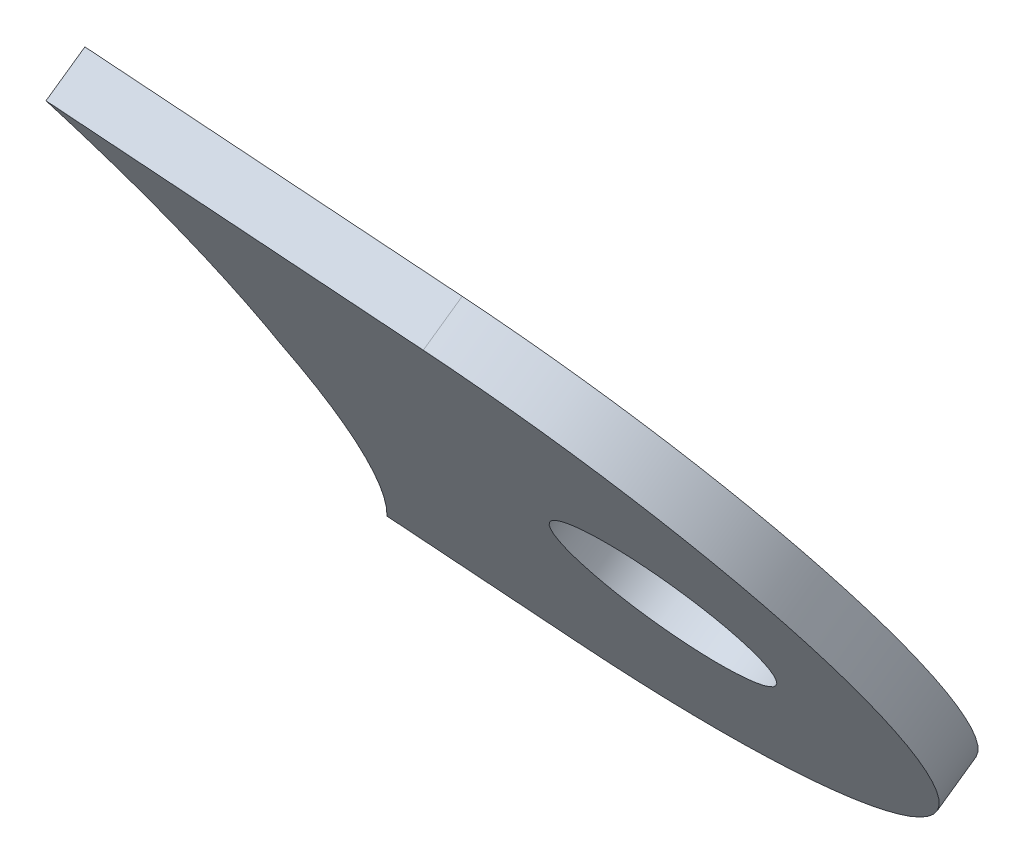
from build123d import *

# Parameters (mm, degrees)
SKETCH1_R           = 3.3019999999999836
BOSS_EXTRUDE1_DEPTH = 1.5875
SKETCH2_R           = 12.7
CUT_EXTRUDE2_DEPTH  = 146.57558110485613
CUT_EXTRUDE3_DEPTH  = 400.917308055041
CUT_EXTRUDE4_DEPTH  = 400.91690405439095


with BuildPart() as part:
    # Sketch1 → Boss-Extrude1 (new body)
    with BuildSketch(Plane(origin=(4.715e-14, 220.81273991226263, -315.3532743689599), x_dir=(-1, 7e-17, -1e-16), z_dir=(0, 0.5735764363510497, -0.8191520442889892))):
        with BuildLine():
            Line((-352.9368830837315, 115.82645369700992), (-375.29590907686907, 107.8750150529707))
            ThreePointArc((-375.29590907686907, 107.8750150529707), (-383.0064063960404, 91.65378726062865), (-366.7851786036984, 83.94328994145738))
            Line((-366.7851786036984, 83.94328994145738), (-352.9368830837315, 88.86809624497586))
            Line((-352.9368830837315, 88.86809624497586), (-352.9368830837315, 115.82645369700992))
        make_face()
        with Locations((-375.5277422986924, 94.31339053349453)):
            Circle(SKETCH1_R, mode=Mode.SUBTRACT)
    extrude(amount=BOSS_EXTRUDE1_DEPTH)

    # Sketch2 → Cut-Extrude2 (cut, through all)
    with BuildSketch(Plane(origin=(364.35174229869244, 343.62540364794484, -135.39966553044988), x_dir=(-0.9960075449626111, 0.027318171664055604, 0.08498639817338811), z_dir=(-0.0892690897094424, -0.3047987291070713, -0.9482240053685426))):
        with Locations((-0.03783689084002617, -0.5075300251178305)):
            Circle(SKETCH2_R)
    extrude(amount=CUT_EXTRUDE2_DEPTH, mode=Mode.SUBTRACT)

    # Sketch3 → Cut-Extrude3 (cut, through all)
    with BuildSketch(Plane(origin=(4.734e-14, 221.72329250496995, -316.65367823926863), x_dir=(-1, 7e-17, -1e-16), z_dir=(0, 0.5735764363510497, -0.8191520442889892))):
        with BuildLine():
            Line((-361.4453353005722, 85.84227411038414), (-360.53395932333007, 86.16638260092915))
            Line((-360.53395932333007, 86.16638260092915), (-363.80419645721065, 111.96176050593412))
            add(Edge.make_bspline(
                [(-363.80419645721065, 111.96176050593412), (-368.8920523914014, 98.57905697453593), (-361.4453353005722, 85.84227411038414)],
                knots=[0.8633594194263924, 0.8633594194263924, 0.8633594194263924, 2.2053014206357777, 2.2053014206357777, 2.2053014206357777], degree=2, weights=[1, 0.7832183186966504, 1]))
        make_face()
    extrude(amount=-CUT_EXTRUDE3_DEPTH, mode=Mode.SUBTRACT)

    # Sketch5 → Cut-Extrude4 (cut, through all)
    with BuildSketch(Plane(origin=(4.715e-14, 220.81273991226263, -315.3532743689599), x_dir=(1, -7e-17, 1e-16), z_dir=(0, -0.5735764363510497, 0.8191520442889892))):
        with BuildLine():
            Line((364.81964209388303, 111.600642196092), (363.80419645721065, 111.96176050593412))
            Line((363.80419645721065, 111.96176050593412), (365.40184998669423, 99.04304749276544))
            add(Edge.make_bspline(
                [(365.40184998669423, 99.04304749276544), (366.3557730480568, 105.71124194209018), (364.81964209388303, 111.600642196092)],
                knots=[4.662458191197461, 4.662458191197461, 4.662458191197461, 5.280973611848554, 5.280973611848554, 5.280973611848554], degree=2, weights=[1, 0.9525597493758428, 1]))
        make_face()
    extrude(amount=-CUT_EXTRUDE4_DEPTH, mode=Mode.SUBTRACT)


solid = part.part
